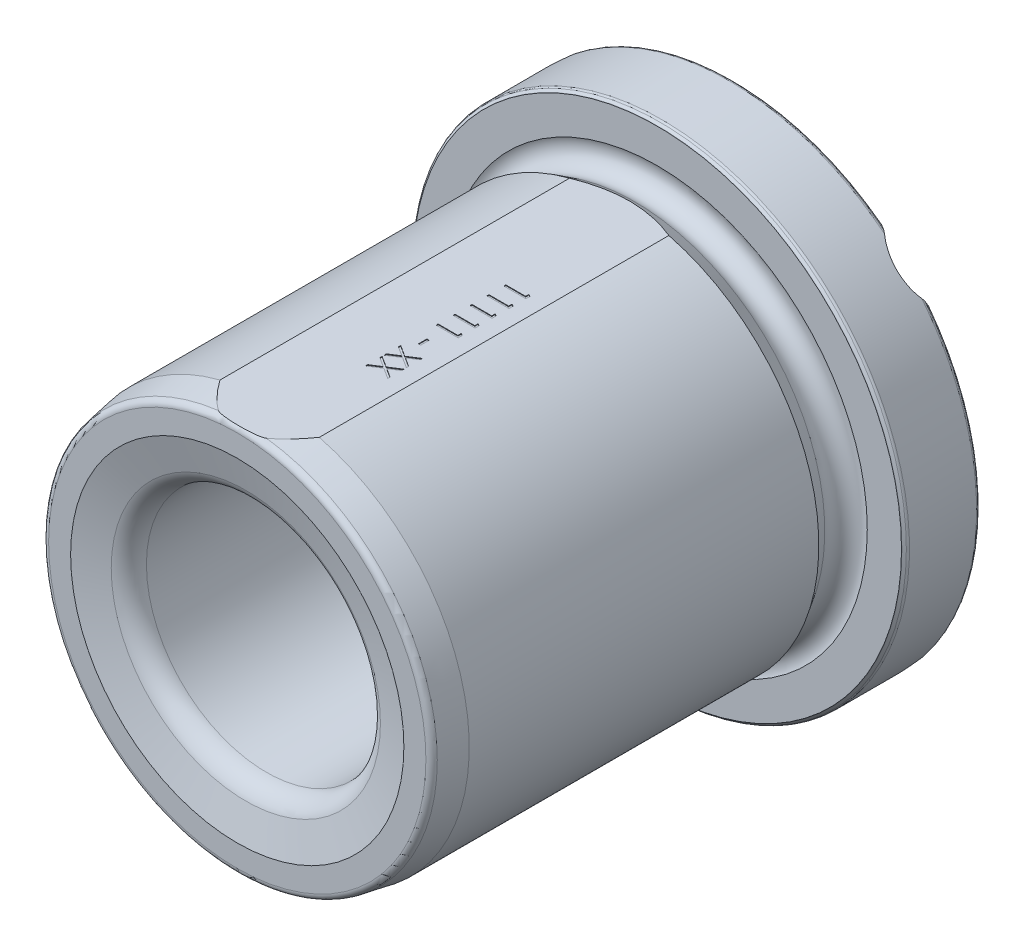
from build123d import *

# Parameters (mm, degrees)
SKETCH2_W          = 23.749496475
SKETCH2_H          = 8.889476334
CUT_EXTRUDE1_DEPTH = 63.5
SKETCH5_W          = 0.358974359
SKETCH5_H          = 1.346153846
PARTNO_DEPTH       = 0.1
SKETCH4_R          = 8
CUT_EXTRUDE2_DEPTH = 66
CIRPATTERN1_COUNT  = 4
SKETCH3_W          = 103.866537798
SKETCH3_H          = 40.861636781


with BuildPart() as part:
    # Sketch1 → Revolve1 (revolve)
    with BuildSketch(Plane(origin=(0, 0, 0), x_dir=(0, 0, -1), z_dir=(1, 0, 0))):
        with BuildLine():
            Line((0, 21.548900035), (0, 38.442893219))
            ThreePointArc((0, 38.442893219), (-0.038060234, 38.634234935), (-0.146446609, 38.796446609))
            Line((-0.146446609, 38.796446609), (-0.603553391, 39.253553391))
            ThreePointArc((-0.603553391, 39.253553391), (-0.765765065, 39.361939766), (-0.957106781, 39.4))
            Line((-0.957106781, 39.4), (-11.642893219, 39.4))
            ThreePointArc((-11.642893219, 39.4), (-11.834234935, 39.361939766), (-11.996446609, 39.253553391))
            Line((-11.996446609, 39.253553391), (-12.353553391, 38.896446609))
            ThreePointArc((-12.353553391, 38.896446609), (-12.461939766, 38.734234935), (-12.5, 38.542893219))
            Line((-12.5, 38.542893219), (-12.5, 33.65))
            ThreePointArc((-12.5, 33.65), (-12.895860273, 30.592974987), (-15.958604366, 30.244111259))
            Line((-15.958604366, 30.244111259), (-18.65, 31.8975))
            Line((-18.65, 31.8975), (-73.15, 31.8975))
            Line((-73.15, 31.8975), (-78.323648178, 30.985246238))
            ThreePointArc((-78.323648178, 30.985246238), (-78.916044443, 30.643226094), (-79.15, 30.000438485))
            Line((-79.15, 30.000438485), (-79.15, 26.5))
            Line((-79.15, 26.5), (-79.15, 26.45))
            Line((-79.15, 26.45), (-77.87566937, 21.694133342))
            ThreePointArc((-77.87566937, 21.694133342), (-76.625593979, 19.823263309), (-74.494928978, 19.1))
            Line((-74.494928978, 19.1), (-4.125860531, 19.1))
            ThreePointArc((-4.125860531, 19.1), (-4.003807467, 19.115125738), (-3.889138974, 19.159587801))
            Line((-3.889138974, 19.159587801), (-0.263278443, 21.108487837))
            ThreePointArc((-0.263278443, 21.108487837), (-0.070837573, 21.292346706), (0, 21.548900035))
        make_face()
    revolve(axis=Axis((0, 0, 0), (0, 0, 1)))

    # Sketch2 → Cut-Extrude1 (cut)
    with BuildSketch(Plane.XY.offset(79.15)):
        with Locations((0.59705438, 35.194738167)):
            Rectangle(SKETCH2_W, SKETCH2_H)
    cut_extrude1 = extrude(amount=-CUT_EXTRUDE1_DEPTH, mode=Mode.SUBTRACT)

    # Mirror1: Cut-Extrude1 across plane
    add(cut_extrude1.mirror(Plane.ZX), mode=Mode.SUBTRACT)

    # Sketch5 → PARTNO (cut)
    with BuildSketch(Plane(origin=(0, 30.75, 0), x_dir=(1, 0, 0), z_dir=(0, 1, 0))):
        Polygon((5.235774342, -37.836425742), (5.235774342, -38.483561158), (1.735774342, -38.483561158), (1.735774342, -38.169458594), (4.876799983, -38.169458594), (4.876799983, -37.630997056), align=None)
        Polygon((5.235774342, -40.528733434), (5.235774342, -41.175868851), (1.735774342, -41.175868851), (1.735774342, -40.861766287), (4.876799983, -40.861766287), (4.876799983, -40.323304748), align=None)
        Polygon((5.235774342, -43.221041126), (5.235774342, -43.868176543), (1.735774342, -43.868176543), (1.735774342, -43.554073979), (4.876799983, -43.554073979), (4.876799983, -43.01561244), align=None)
        Polygon((5.235774342, -45.913348819), (5.235774342, -46.560484235), (1.735774342, -46.560484235), (1.735774342, -46.246381671), (4.876799983, -46.246381671), (4.876799983, -45.707920133), align=None)
        Polygon((5.235774342, -48.605656511), (5.235774342, -49.252791928), (1.735774342, -49.252791928), (1.735774342, -48.938689363), (4.876799983, -48.938689363), (4.876799983, -48.400227825), align=None)
        with Locations((3.081928189, -52.573304748)):
            Rectangle(SKETCH5_W, SKETCH5_H)
        Polygon((5.235774342, -54.929073979), (5.235774342, -55.291553947), (3.804784759, -56.207219011), (5.235774342, -57.122182953), (5.235774342, -57.486766287), (3.520830432, -56.389510678), (1.735774342, -57.531638081), (1.735774342, -57.169158113), (3.237577227, -56.207920133), (1.735774342, -55.247383274), (1.735774342, -54.884202184), (3.521531554, -56.026329588), align=None)
        Polygon((5.235774342, -57.89061244), (5.235774342, -58.253092408), (3.804784759, -59.168757472), (5.235774342, -60.083721415), (5.235774342, -60.448304748), (3.520830432, -59.351049139), (1.735774342, -60.493176543), (1.735774342, -60.130696575), (3.237577227, -59.169458594), (1.735774342, -58.208921735), (1.735774342, -57.845740645), (3.521531554, -58.987868049), align=None)
    extrude(amount=-PARTNO_DEPTH, mode=Mode.SUBTRACT)

    # Sketch4 → Cut-Extrude2 (cut)
    with BuildSketch(Plane(origin=(0, 0, 0), x_dir=(0, 0, -1), z_dir=(0.7071067811865488, 0.7071067811865462, 0))):
        with Locations((5.85, 0)):
            Circle(SKETCH4_R)
    cut_extrude2 = extrude(amount=-CUT_EXTRUDE2_DEPTH, mode=Mode.SUBTRACT)

    # CirPattern1: Cut-Extrude2 ×4 about axis
    cirpattern1_axis = Axis((0, 0, 18.65), (0, 0, 1))
    for i in range(1, CIRPATTERN1_COUNT):
        add(cut_extrude2.rotate(cirpattern1_axis, i * 360 / CIRPATTERN1_COUNT), mode=Mode.SUBTRACT)

    # Sketch3 → Cut-Revolve1 (revolve, cut)
    with BuildSketch(Plane(origin=(0, 0, 0), x_dir=(0, 0, -1), z_dir=(1, 0, 0))):
        with Locations((-39.166018409, 30.231076287)):
            Rectangle(SKETCH3_W, SKETCH3_H)
        with BuildLine():
            Line((-79.15, 26.5), (-76.750739653, 17.545838484))
            Line((-76.750739653, 17.545838484), (-0.15, 17.545838484))
            Line((-0.15, 17.545838484), (-0.15, 40.923802074))
            Line((-0.15, 40.923802074), (-12.38, 40.923802074))
            Line((-12.38, 40.923802074), (-12.38, 33.2475))
            ThreePointArc((-12.38, 33.2475), (-12.819339828, 32.186839828), (-13.88, 31.7475))
            Line((-13.88, 31.7475), (-79.15, 31.7475))
            Line((-79.15, 31.7475), (-79.15, 26.5))
        make_face(mode=Mode.SUBTRACT)
    revolve(axis=Axis((0, 0, 0), (0, 0, 1)), mode=Mode.SUBTRACT)


solid = part.part
